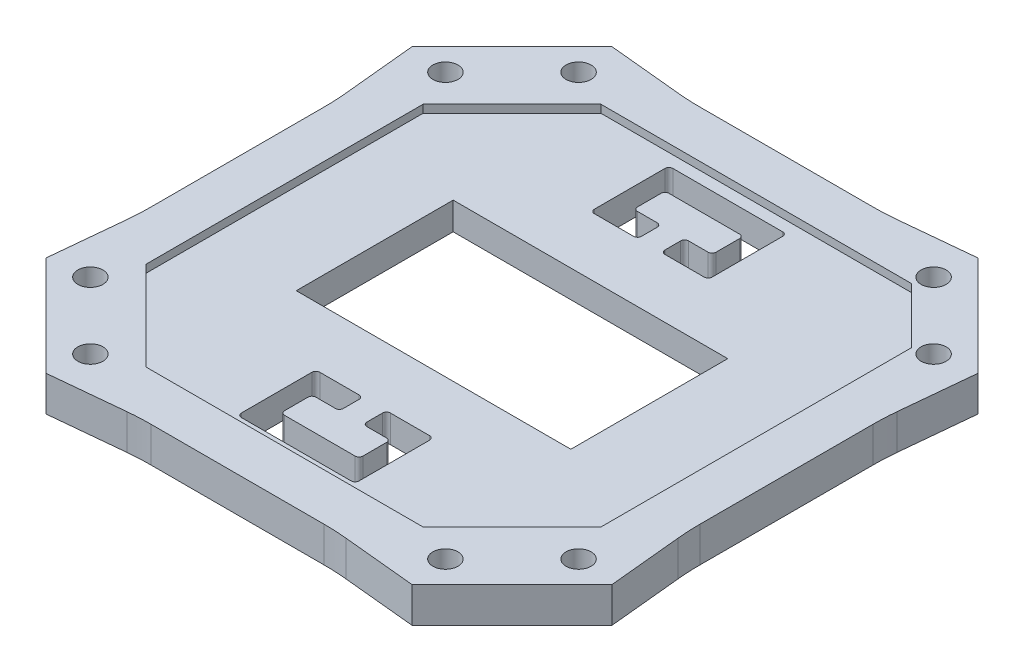
from build123d import *

# Parameters (mm, degrees)
SKETCH2_R           = 1.6
BOSS_EXTRUDE1_DEPTH = 4.5
CUT_EXTRUDE1_DEPTH  = 1
FILLET2_R           = 30
CUT_EXTRUDE4_DEPTH  = 52.119956964
SKETCH11_W          = 35
SKETCH11_H          = 20
CUT_EXTRUDE5_DEPTH  = 52.119956964


with BuildPart() as part:
    # Sketch2 → Boss-Extrude1 (new body)
    with BuildSketch(Plane(origin=(0, 0, 0), x_dir=(1, 0, 0), z_dir=(0, 1, 0))):
        Polygon((-12.5, 35), (12.5, 35), (23.334523779, 36.062445841), (36.062445841, 23.334523779), (35, 12.5), (35, -12.5), (36.062445841, -23.334523779), (23.334523779, -36.062445841), (12.5, -35), (-12.5, -35), (-23.334523779, -36.062445841), (-36.062445841, -23.334523779), (-35, -12.5), (-35, 12.5), (-36.062445841, 23.334523779), (-23.334523779, 36.062445841), align=None)
        with Locations(Location((22.627416998, 31.112698372, 0), (0, 0, 270))):
            Circle(SKETCH2_R, mode=Mode.SUBTRACT)
        with Locations(Location((31.112698372, 22.627416998, 0), (0, 0, 270))):
            Circle(SKETCH2_R, mode=Mode.SUBTRACT)
        with Locations(Location((22.627416998, -31.112698372, 0), (0, 0, 270))):
            Circle(SKETCH2_R, mode=Mode.SUBTRACT)
        with Locations(Location((31.112698372, -22.627416998, 0), (0, 0, 270))):
            Circle(SKETCH2_R, mode=Mode.SUBTRACT)
        with Locations(Location((-31.112698372, -22.627416998, 0), (0, 0, 270))):
            Circle(SKETCH2_R, mode=Mode.SUBTRACT)
        with Locations(Location((-22.627416998, -31.112698372, 0), (0, 0, 270))):
            Circle(SKETCH2_R, mode=Mode.SUBTRACT)
        with Locations(Location((-22.627416998, 31.112698372, 0), (0, 0, 270))):
            Circle(SKETCH2_R, mode=Mode.SUBTRACT)
        with Locations(Location((-31.112698372, 22.627416998, 0), (0, 0, 270))):
            Circle(SKETCH2_R, mode=Mode.SUBTRACT)
    extrude(amount=BOSS_EXTRUDE1_DEPTH)

    # Sketch3 → Cut-Extrude1 (cut)
    with BuildSketch(Plane(origin=(0, 4.5, 0), x_dir=(1, 0, 0), z_dir=(0, 1, 0))):
        Polygon((-17.669047558, 29), (21.911688245, 29), (29, 21.911688245), (29, -17.669047558), (17.669047558, -29), (-17.669047558, -29), (-29, -17.669047558), (-29, 17.669047558), align=None)
    extrude(amount=-CUT_EXTRUDE1_DEPTH, mode=Mode.SUBTRACT)

    # Fillet2
    # the kernel refuses this fillet: 30 mm, written as the material it adds along each edge
    with BuildSketch(Plane(origin=(-12.5, 0, -35), x_dir=(1, 0, 0), z_dir=(0, 1, 0))) as fillet2_piece_1:
        with BuildLine():
            CenterArc((FILLET2_R * 0.0489132680018, FILLET2_R), FILLET2_R, 264.399415997, 5.600584003)
            Line((-FILLET2_R * 0.0486797758844, FILLET2_R * 0.00477359471072), (0, 0))
            Line((0, 0), (FILLET2_R * 0.0489132680018, 0))
        make_face()
    extrude(amount=4.5)
    with BuildSketch(Plane(origin=(12.5, 0, -35), x_dir=(-1, 0, 0), z_dir=(0, 1, 0)), Plane(origin=(35, 0, -12.5), x_dir=(0.09759304388620155, 0, -0.9952264052892819), z_dir=(0, 1, 0)), Plane(origin=(35, 0, 12.5), x_dir=(0, 0, -1), z_dir=(0, 1, 0)), Plane(origin=(12.5, 0, 35), x_dir=(0.9952264052892817, 0, 0.09759304388620309), z_dir=(0, 1, 0)), Plane(origin=(-12.5, 0, 35), x_dir=(1, 0, 0), z_dir=(0, 1, 0)), Plane(origin=(-35, 0, 12.5), x_dir=(-0.09759304388619769, 0, 0.9952264052892822), z_dir=(0, 1, 0)), Plane(origin=(-35, 0, -12.5), x_dir=(0, 0, 1), z_dir=(0, 1, 0))) as fillet2_piece_2:
        with BuildLine():
            CenterArc((FILLET2_R * 0.048913268002, -FILLET2_R), FILLET2_R, 90, 5.600584003)
            Line((-FILLET2_R * 0.0486797758846, -FILLET2_R * 0.00477359471075), (0, 0))
            Line((0, 0), (FILLET2_R * 0.048913268002, 0))
        make_face()
    extrude(amount=4.5)

    # Sketch10 → Cut-Extrude4 (cut, through all)
    with BuildSketch(Plane(origin=(0, 3.5, 0), x_dir=(1, 0, 0), z_dir=(0, 1, 0))):
        with BuildLine():
            Line((-1.5, 20), (-1.5, 18))
            ThreePointArc((-1.5, 18), (-1.646446609, 17.646446609), (-2, 17.5))
            Line((-2, 17.5), (-7, 17.5))
            ThreePointArc((-7, 17.5), (-7.353553391, 17.646446609), (-7.5, 18))
            Line((-7.5, 18), (-7.5, 27))
            ThreePointArc((-7.5, 27), (-7.353553391, 27.353553391), (-7, 27.5))
            Line((-7, 27.5), (7, 27.5))
            ThreePointArc((7, 27.5), (7.353553391, 27.353553391), (7.5, 27))
            Line((7.5, 27), (7.5, 18))
            ThreePointArc((7.5, 18), (7.353553391, 17.646446609), (7, 17.5))
            Line((7, 17.5), (2, 17.5))
            ThreePointArc((2, 17.5), (1.646446609, 17.646446609), (1.5, 18))
            Line((1.5, 18), (1.5, 20))
            ThreePointArc((1.5, 20), (1.646446609, 20.353553391), (2, 20.5))
            Line((2, 20.5), (4.5, 20.5))
            ThreePointArc((4.5, 20.5), (4.853553391, 20.646446609), (5, 21))
            Line((5, 21), (5, 24))
            ThreePointArc((5, 24), (4.853553391, 24.353553391), (4.5, 24.5))
            Line((4.5, 24.5), (-4.5, 24.5))
            ThreePointArc((-4.5, 24.5), (-4.853553391, 24.353553391), (-5, 24))
            Line((-5, 24), (-5, 21))
            ThreePointArc((-5, 21), (-4.853553391, 20.646446609), (-4.5, 20.5))
            Line((-4.5, 20.5), (-2, 20.5))
            ThreePointArc((-2, 20.5), (-1.646446609, 20.353553391), (-1.5, 20))
        make_face()
        with BuildLine():
            Line((-2, -20.5), (-4.5, -20.5))
            ThreePointArc((-4.5, -20.5), (-4.853553391, -20.646446609), (-5, -21))
            Line((-5, -21), (-5, -24))
            ThreePointArc((-5, -24), (-4.853553391, -24.353553391), (-4.5, -24.5))
            Line((-4.5, -24.5), (4.5, -24.5))
            ThreePointArc((4.5, -24.5), (4.853553391, -24.353553391), (5, -24))
            Line((5, -24), (5, -21))
            ThreePointArc((5, -21), (4.853553391, -20.646446609), (4.5, -20.5))
            Line((4.5, -20.5), (2, -20.5))
            ThreePointArc((2, -20.5), (1.646446609, -20.353553391), (1.5, -20))
            Line((1.5, -20), (1.5, -18))
            ThreePointArc((1.5, -18), (1.646446609, -17.646446609), (2, -17.5))
            Line((2, -17.5), (7, -17.5))
            ThreePointArc((7, -17.5), (7.353553391, -17.646446609), (7.5, -18))
            Line((7.5, -18), (7.5, -27))
            ThreePointArc((7.5, -27), (7.353553391, -27.353553391), (7, -27.5))
            Line((7, -27.5), (-7, -27.5))
            ThreePointArc((-7, -27.5), (-7.353553391, -27.353553391), (-7.5, -27))
            Line((-7.5, -27), (-7.5, -18))
            ThreePointArc((-7.5, -18), (-7.353553391, -17.646446609), (-7, -17.5))
            Line((-7, -17.5), (-2, -17.5))
            ThreePointArc((-2, -17.5), (-1.646446609, -17.646446609), (-1.5, -18))
            Line((-1.5, -18), (-1.5, -20))
            ThreePointArc((-1.5, -20), (-1.646446609, -20.353553391), (-2, -20.5))
        make_face()
    extrude(amount=-CUT_EXTRUDE4_DEPTH, mode=Mode.SUBTRACT)

    # Sketch11 → Cut-Extrude5 (cut, through all)
    with BuildSketch(Plane(origin=(0, 3.5, 0), x_dir=(1, 0, 0), z_dir=(0, 1, 0))):
        Rectangle(SKETCH11_W, SKETCH11_H)
    extrude(amount=-CUT_EXTRUDE5_DEPTH, mode=Mode.SUBTRACT)


solid = part.part
